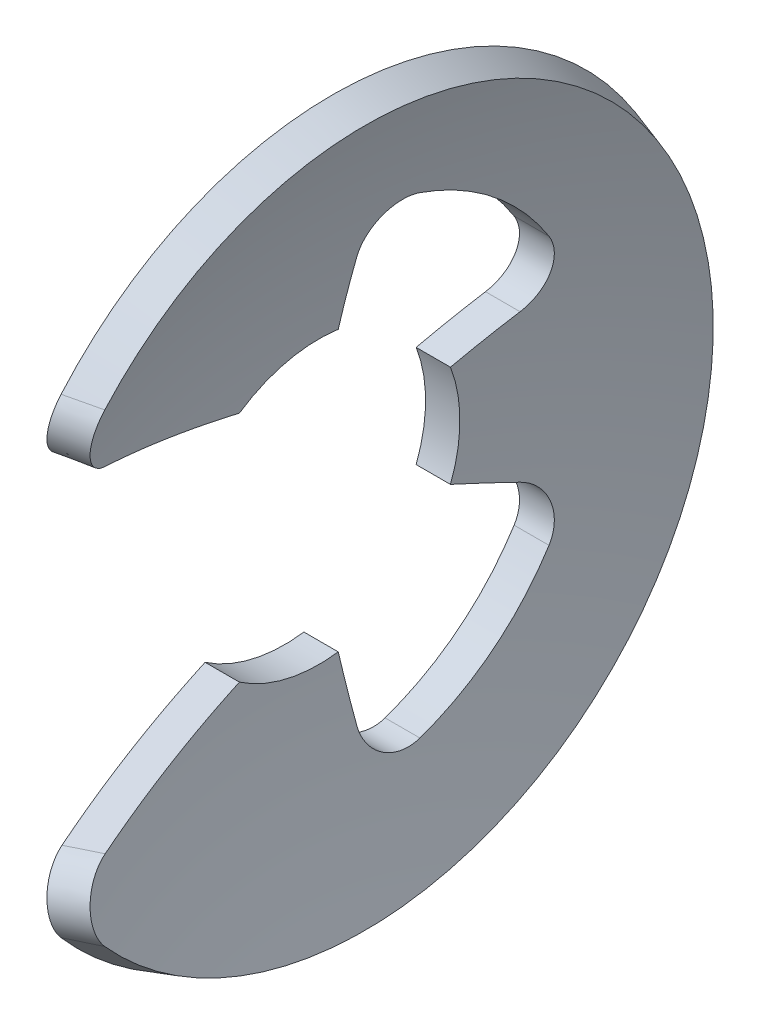
from build123d import *

# Parameters (mm, degrees)
CUT_EXTRUDE1_DEPTH = 10.608101884
FILLET1_R          = 0.762


with BuildPart() as part:
    # Sketch2 → Revolve1 (revolve)
    with BuildSketch(Plane(origin=(0, 0, 0), x_dir=(1, 0, 0), z_dir=(0, 1, 0))):
        with BuildLine():
            Line((0.41129695, 6.6929), (1.016, 6.499097983))
            ThreePointArc((1.016, 6.499097983), (0.255533191, 3.289016973), (0, 0))
            Line((0, 0), (-0.635, 0))
            ThreePointArc((-0.635, 0), (-0.371846852, 3.38709491), (0.41129695, 6.6929))
        make_face()
    revolve(axis=Axis((0, 0, 0), (1, 0, 0)))

    # Sketch1 → Cut-Extrude1 (cut, through all)
    with BuildSketch(Plane(origin=(1.016, 0, 0), x_dir=(0, 0, -1), z_dir=(1, 0, 0))):
        with BuildLine():
            Line((-5.711929949, -3.488375935), (-1.481934955, -2.171401391))
            ThreePointArc((-1.481934955, -2.171401391), (-0.600870128, -2.559310512), (0.360768614, -2.604027883))
            Line((0.360768614, -2.604027883), (0.639623582, -4.616803059))
            ThreePointArc((0.639623582, -4.616803059), (2.89470911, -3.653032709), (4.34839739, -1.677924))
            Line((4.34839739, -1.677924), (2.45263831, -0.946404))
            ThreePointArc((2.45263831, -0.946404), (2.6289, 0), (2.45263831, 0.946404))
            Line((2.45263831, 0.946404), (4.34839739, 1.677924))
            ThreePointArc((4.34839739, 1.677924), (2.89470911, 3.653032709), (0.639623582, 4.616803059))
            Line((0.639623582, 4.616803059), (0.360768614, 2.604027883))
            ThreePointArc((0.360768614, 2.604027883), (-0.600870128, 2.559310512), (-1.481934955, 2.171401391))
            Line((-1.481934955, 2.171401391), (-5.711929949, 3.488375935))
            ThreePointArc((-5.711929949, 3.488375935), (-6.6929, 0), (-5.711929949, -3.488375935))
        make_face()
    extrude(amount=-CUT_EXTRUDE1_DEPTH, mode=Mode.SUBTRACT)

    # Fillet1
    fillet1_edges = [part.edges().sort_by_distance(p)[0] for p in [
        (0.191190066, 4.616803059, -0.639623582),
        (0.191190066, 1.677924, -4.34839739),
        (0.191190066, -1.677924, -4.34839739),
        (0.191190066, -4.616803059, -0.639623582),
        (0.713662776, 3.458657833, 5.616478276),
        (0.713662776, -3.458657833, 5.616478276),
    ]]
    fillet(fillet1_edges, radius=FILLET1_R)


solid = part.part
